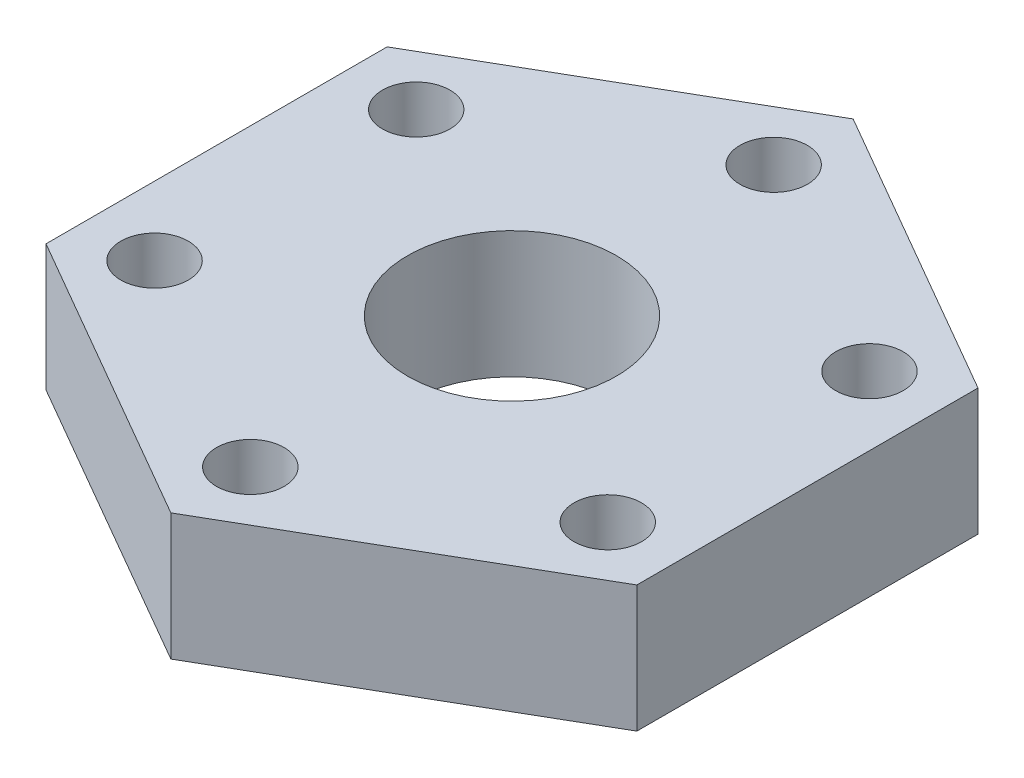
from build123d import *

# Parameters (mm, degrees)
SKETCH1_R           = 2.475
SKETCH1_R_2         = 0.8
BOSS_EXTRUDE1_DEPTH = 3


with BuildPart() as part:
    # Sketch1 → Boss-Extrude1 (new body)
    with BuildSketch(Plane(origin=(0, 0, 0), x_dir=(1, 0, 0), z_dir=(0, 1, 0))):
        Polygon((-7, -4.041451884), (0, -8.082903769), (7, -4.041451884), (7, 4.041451884), (0, 8.082903769), (-7, 4.041451884), align=None)
        Circle(SKETCH1_R, mode=Mode.SUBTRACT)
        with Locations((-5.369357503, 3.1)):
            Circle(SKETCH1_R_2, mode=Mode.SUBTRACT)
        with Locations((0, 6.2)):
            Circle(SKETCH1_R_2, mode=Mode.SUBTRACT)
        with Locations((5.369357503, 3.1)):
            Circle(SKETCH1_R_2, mode=Mode.SUBTRACT)
        with Locations((5.369357503, -3.1)):
            Circle(SKETCH1_R_2, mode=Mode.SUBTRACT)
        with Locations((0, -6.2)):
            Circle(SKETCH1_R_2, mode=Mode.SUBTRACT)
        with Locations((-5.369357503, -3.1)):
            Circle(SKETCH1_R_2, mode=Mode.SUBTRACT)
    extrude(amount=BOSS_EXTRUDE1_DEPTH)


solid = part.part
